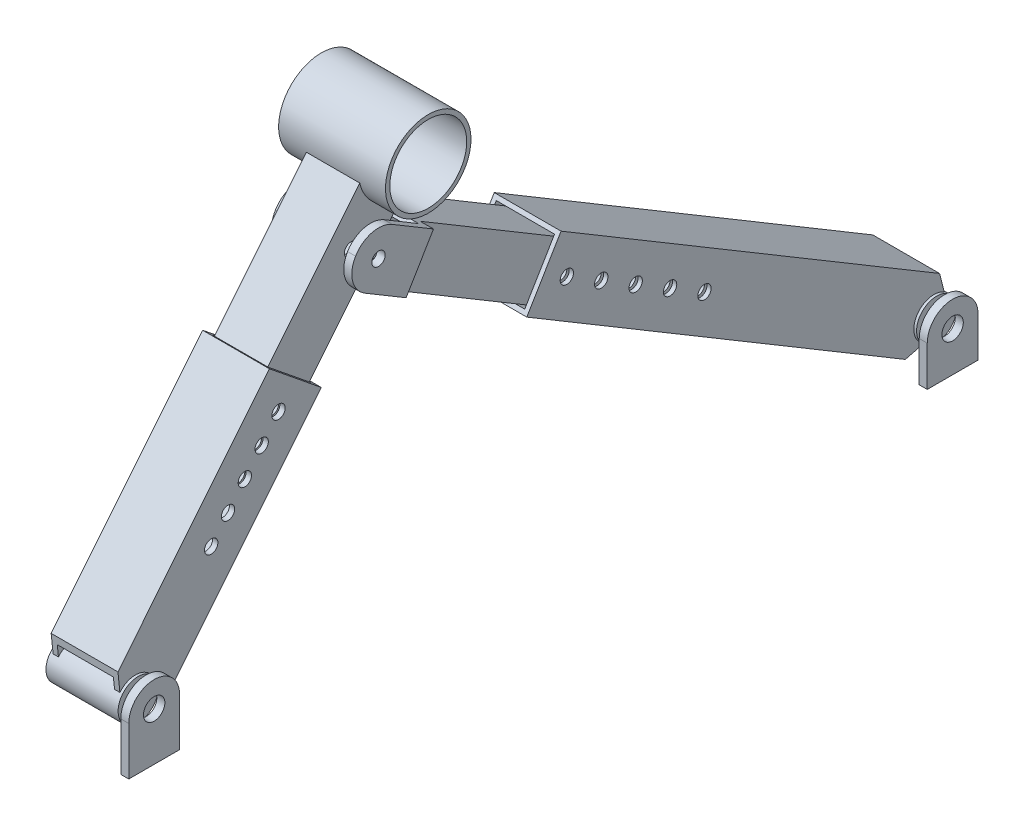
from build123d import *

# Parameters (mm, degrees)
SKETCH4_W              = 25
SKETCH4_H              = 25
SKETCH4_W_2            = 21
SKETCH4_H_2            = 21
BOSS_EXTRUDE3_DEPTH    = 95
SKETCH9_W              = 25
SKETCH9_H              = 25
SKETCH9_W_2            = 21.8
SKETCH9_H_2            = 21.8
BOSS_EXTRUDE6_DEPTH    = 170
SKETCH7_R              = 7.5
CUT_EXTRUDE2_DEPTH     = 85
SKETCH2_R              = 7.5
SKETCH2_R_2            = 4
BOSS_EXTRUDE2_DEPTH    = 13.5
BOSS_EXTRUDE4_START    = 60
SKETCH5_W              = 20
SKETCH5_H              = 20
SKETCH5_W_2            = 16
SKETCH5_H_2            = 16
BOSS_EXTRUDE4_DEPTH    = 72.060893
BOSS_EXTRUDE7_START    = -70
SKETCH10_W             = 20
SKETCH10_H             = 20
SKETCH10_W_2           = 16
SKETCH10_H_2           = 16
BOSS_EXTRUDE7_DEPTH    = 160
SKETCH17_W             = 20
SKETCH17_H             = 20
SKETCH17_W_2           = 16
SKETCH17_H_2           = 16
BOSS_EXTRUDE11_DEPTH   = 30
SKETCH11_R             = 16
CUT_EXTRUDE3_DEPTH     = 12.5
SKETCH12_R             = 16
SKETCH12_R_2           = 14.4
BOSS_EXTRUDE8_DEPTH    = 20
CHAMFER1_SIZE          = 5
CHAMFER2_SIZE          = 5
SKETCH13_R             = 2.5
CUT_EXTRUDE4_DEPTH     = 20
SKETCH15_R             = 2.5
CUT_EXTRUDE5_DEPTH     = 20
LPATTERN1_COUNT        = 5
LPATTERN1_PITCH        = 10
LPATTERN2_COUNT        = 5
LPATTERN2_PITCH        = 15
BOSS_EXTRUDE10_START   = 18
SKETCH16_R             = 4
BOSS_EXTRUDE10_DEPTH   = 1.5
BOSS_EXTRUDE10_2_DEPTH = 1.5
SKETCH18_W             = 5
SKETCH18_H             = 20
BOSS_EXTRUDE12_DEPTH   = 3
SKETCH19_W             = 3
SKETCH19_H             = 20
BOSS_EXTRUDE13_DEPTH   = 25
FILLET1_R              = 10
SKETCH20_R             = 2.5
CUT_EXTRUDE6_DEPTH     = 25
SKETCH21_R             = 2.5
CUT_EXTRUDE7_DEPTH     = 40


# Some blends are built 0.0001 mm under size
with BuildPart() as part:
    # Sketch4 → Boss-Extrude3 (new body)
    with BuildSketch(Plane(origin=(0, 0, 0), x_dir=(-1, 0, 0), z_dir=(0, 0.776655857872885, -0.629925137164515))):
        Rectangle(SKETCH4_W, SKETCH4_H)
        Rectangle(SKETCH4_W_2, SKETCH4_H_2, mode=Mode.SUBTRACT)
    extrude(amount=BOSS_EXTRUDE3_DEPTH)


with BuildPart() as body_2:
    # Sketch9 → Boss-Extrude6 (new body)
    with BuildSketch(Plane(origin=(0, -26.146722824, -298.858409428), x_dir=(-1, 0, 0), z_dir=(0, -0.5124761188021193, -0.858701477614611))):
        Rectangle(SKETCH9_W, SKETCH9_H)
        Rectangle(SKETCH9_W_2, SKETCH9_H_2, mode=Mode.SUBTRACT)
    extrude(amount=-BOSS_EXTRUDE6_DEPTH)


with BuildPart() as cut_extrude2_tool:
    # Sketch7 → Cut-Extrude2 (new, symmetric)
    with BuildSketch(Plane(origin=(0, 0, 0), x_dir=(0, 0, -1), z_dir=(1, 0, 0))):
        Circle(SKETCH7_R)
        with Locations((298.858409428, -26.146722824)):
            Circle(SKETCH7_R)
    extrude(amount=CUT_EXTRUDE2_DEPTH, both=True)


with BuildPart() as part_1:
    add(part.part)

    # Cut-Extrude2: cut by cut_extrude2_tool
    add(cut_extrude2_tool.part, mode=Mode.SUBTRACT)



with BuildPart() as body_2_1:
    add(body_2.part)

    # Cut-Extrude2: cut by cut_extrude2_tool
    add(cut_extrude2_tool.part, mode=Mode.SUBTRACT)


with BuildPart() as part_2:
    add(part_1.part)

    add(body_2_1.part)  # Boss-Extrude2 merges body 2
    # Sketch2 → Boss-Extrude2 (add, symmetric)
    # profile 1 of 2: a face of its own
    with BuildSketch(Plane(origin=(0, 0, 0), x_dir=(0, 0, -1), z_dir=(1, 0, 0))):
        Circle(SKETCH2_R)
        Circle(SKETCH2_R_2, mode=Mode.SUBTRACT)
    # profile 2 of 2: a face of its own
    with BuildSketch(Plane(origin=(0, 0, 0), x_dir=(0, 0, -1), z_dir=(1, 0, 0))):
        with Locations((298.858409428, -26.146722824)):
            Circle(SKETCH2_R)
        with Locations((298.858409428, -26.146722824)):
            Circle(SKETCH2_R_2, mode=Mode.SUBTRACT)
    extrude(amount=BOSS_EXTRUDE2_DEPTH, both=True)

    # Chamfer1
    # the kernel refuses this chamfer: 5 mm, written as the material it takes off along each edge
    with BuildSketch(Plane(origin=(25.35841494, -7.874064215, -9.708198223), x_dir=(0, 0.7590418735818988, -0.6510418067599658), z_dir=(-1, 0, 0))) as chamfer1_piece_1_section:
        Polygon((CHAMFER1_SIZE * 0.999621916911, -CHAMFER1_SIZE * 0.0274958766106), (-CHAMFER1_SIZE * 0.0274958766106, -CHAMFER1_SIZE * 0.999621916911), (0, 0), align=None)
    chamfer1_piece_1 = extrude(amount=50.71682988, mode=Mode.PRIVATE)
    chamfer1_piece_1 = chamfer1_piece_1 - Plane(origin=(0, 0, 0), x_dir=(0, 0, -1), z_dir=(1, 0, 0)) * Cylinder(7.5, 122, mode=Mode.PRIVATE)
    add(chamfer1_piece_1, mode=Mode.SUBTRACT)
    with BuildSketch(Plane(origin=(-25.35841494, 7.874064215, 9.708198223), x_dir=(0, -0.651041806759966, -0.7590418735818988), z_dir=(1, 0, 0))) as chamfer1_piece_2_section:
        Polygon((CHAMFER1_SIZE * 0.999621916911, CHAMFER1_SIZE * 0.0274958766106), (-CHAMFER1_SIZE * 0.0274958766106, CHAMFER1_SIZE * 0.999621916911), (0, 0), align=None)
    chamfer1_piece_2 = extrude(amount=50.71682988, mode=Mode.PRIVATE)
    chamfer1_piece_2 = chamfer1_piece_2 - Plane(origin=(0, 0, 0), x_dir=(0, 0, -1), z_dir=(1, 0, 0)) * Cylinder(7.5, 122, mode=Mode.PRIVATE)
    add(chamfer1_piece_2, mode=Mode.SUBTRACT)

    # Chamfer2
    # the kernel refuses this chamfer: 5 mm, written as the material it takes off along each edge
    with BuildSketch(Plane(origin=(25.35841494, -15.412954354, -305.264360913), x_dir=(0, 0.5358931101220563, 0.8442858369792244), z_dir=(-1, 0, 0))) as chamfer2_piece_1_section:
        Polygon((CHAMFER2_SIZE * 0.999621916911, -CHAMFER2_SIZE * 0.0274958766106), (-CHAMFER2_SIZE * 0.0274958766106, -CHAMFER2_SIZE * 0.999621916911), (0, 0), align=None)
    chamfer2_piece_1 = extrude(amount=50.71682988, mode=Mode.PRIVATE)
    chamfer2_piece_1 = chamfer2_piece_1 - Plane(origin=(0, -26.146722824, -298.858409428), x_dir=(0, 0, -1), z_dir=(1, 0, 0)) * Cylinder(7.5, 122, mode=Mode.PRIVATE)
    add(chamfer2_piece_1, mode=Mode.SUBTRACT)
    with BuildSketch(Plane(origin=(-25.35841494, -36.880491294, -292.452457942), x_dir=(0, 0.4886716103744133, 0.8724677972361372), z_dir=(1, 0, 0))) as chamfer2_piece_2_section:
        Polygon((CHAMFER2_SIZE * 0.999621916911, -CHAMFER2_SIZE * 0.0274958766106), (-CHAMFER2_SIZE * 0.0274958766106, -CHAMFER2_SIZE * 0.999621916911), (0, 0), align=None)
    chamfer2_piece_2 = extrude(amount=50.71682988, mode=Mode.PRIVATE)
    chamfer2_piece_2 = chamfer2_piece_2 - Plane(origin=(0, -26.146722824, -298.858409428), x_dir=(0, 0, -1), z_dir=(1, 0, 0)) * Cylinder(7.5, 122, mode=Mode.PRIVATE)
    add(chamfer2_piece_2, mode=Mode.SUBTRACT)


with BuildPart() as body_2_2:
    # Sketch5 → Boss-Extrude4 (new body)
    with BuildSketch(Plane(origin=(0, 0, 0), x_dir=(-1, 0, 0), z_dir=(0, 0.776655857872885, -0.629925137164515)).offset(BOSS_EXTRUDE4_START)):
        Rectangle(SKETCH5_W, SKETCH5_H)
        Rectangle(SKETCH5_W_2, SKETCH5_H_2, mode=Mode.SUBTRACT)
    extrude(amount=BOSS_EXTRUDE4_DEPTH)

    # Sketch17 → Boss-Extrude11 (add)
    with BuildSketch(Plane(origin=(0, 102.56586616, -83.18847615), x_dir=(1, 0, 0), z_dir=(0, 0.7766558578728849, -0.6299251371645154))):
        Rectangle(SKETCH17_W, SKETCH17_H)
        Rectangle(SKETCH17_W_2, SKETCH17_H_2, mode=Mode.SUBTRACT)
    extrude(amount=BOSS_EXTRUDE11_DEPTH)

    # Sketch11 → Cut-Extrude3 (cut, symmetric)
    with BuildSketch(Plane(origin=(0, 0, 0), x_dir=(0, 0, -1), z_dir=(1, 0, 0))):
        with Locations((102.086230265, 125.865541896)):
            Circle(SKETCH11_R)
    extrude(amount=CUT_EXTRUDE3_DEPTH, both=True, mode=Mode.SUBTRACT)

    # Sketch12 → Boss-Extrude8 (add, symmetric)
    with BuildSketch(Plane(origin=(0, 0, 0), x_dir=(0, 0, -1), z_dir=(1, 0, 0))):
        with Locations((102.086230265, 125.865541896)):
            Circle(SKETCH12_R)
        with Locations((102.086230265, 125.865541896)):
            Circle(SKETCH12_R_2, mode=Mode.SUBTRACT)
    extrude(amount=BOSS_EXTRUDE8_DEPTH, both=True)


with BuildPart() as body_3:
    # Sketch10 → Boss-Extrude7 (new body)
    with BuildSketch(Plane(origin=(0, -26.146722824, -298.858409428), x_dir=(-1, 0, 0), z_dir=(0, -0.5124761188021193, -0.858701477614611)).offset(BOSS_EXTRUDE7_START)):
        Rectangle(SKETCH10_W, SKETCH10_H)
        Rectangle(SKETCH10_W_2, SKETCH10_H_2, mode=Mode.SUBTRACT)
    extrude(amount=-BOSS_EXTRUDE7_DEPTH)


with BuildPart() as cut_extrude4_tool:
    # Sketch13 → Cut-Extrude4 (new, symmetric)
    with BuildSketch(Plane(origin=(0, 0, 0), x_dir=(0, 0, -1), z_dir=(1, 0, 0))):
        with Locations(Location((53.543636659, 66.015747919, 0), (0, 0, 180))):
            Circle(SKETCH13_R)
    cut_extrude4 = extrude(amount=CUT_EXTRUDE4_DEPTH, both=True)


with BuildPart() as part_3:
    add(part_2.part)

    # Cut-Extrude4: cut by cut_extrude4_tool
    add(cut_extrude4_tool.part, mode=Mode.SUBTRACT)


with BuildPart() as body_2_2_1:
    add(body_2_2.part)

    # Cut-Extrude4: cut by cut_extrude4_tool
    add(cut_extrude4_tool.part, mode=Mode.SUBTRACT)


with BuildPart() as cut_extrude5_tool:
    # Sketch15 → Cut-Extrude5 (new, symmetric)
    with BuildSketch(Plane(origin=(0, 0, 0), x_dir=(0, 0, -1), z_dir=(1, 0, 0))):
        with Locations(Location((161.466173009, 55.849456184, 0), (0, 0, 180))):
            Circle(SKETCH15_R)
    cut_extrude5 = extrude(amount=CUT_EXTRUDE5_DEPTH, both=True)


with BuildPart() as part_4:
    add(part_3.part)

    # Cut-Extrude5: cut by cut_extrude5_tool
    add(cut_extrude5_tool.part, mode=Mode.SUBTRACT)


with BuildPart() as body_3_1:
    add(body_3.part)

    # Cut-Extrude5: cut by cut_extrude5_tool
    add(cut_extrude5_tool.part, mode=Mode.SUBTRACT)


with BuildPart() as lpattern1_tool:
    # LPattern1: Cut-Extrude4 ×5
    with Locations(*[Vector(0, -0.7766558578728853, 0.6299251371645148) * (i * LPATTERN1_PITCH) for i in range(1, LPATTERN1_COUNT)]):
        add(cut_extrude4)


with BuildPart() as part_5:
    add(part_4.part)

    # LPattern1: cut by lpattern1_tool
    add(lpattern1_tool.part, mode=Mode.SUBTRACT)


with BuildPart() as body_2_2_2:
    add(body_2_2_1.part)

    # LPattern1: cut by lpattern1_tool
    add(lpattern1_tool.part, mode=Mode.SUBTRACT)

    # Sketch20 → Cut-Extrude6 (cut)
    with BuildSketch(Plane(origin=(10, 0, 0), x_dir=(0, 0, -1), z_dir=(1, 0, 0))):
        with Locations((83.18847615, 102.56586616)):
            Circle(SKETCH20_R)
    extrude(amount=-CUT_EXTRUDE6_DEPTH, mode=Mode.SUBTRACT)


with BuildPart() as lpattern2_tool:
    # LPattern2: Cut-Extrude5 ×5
    with Locations(*[Vector(0, -0.5124761188021193, -0.8587014776146109) * (i * LPATTERN2_PITCH) for i in range(1, LPATTERN2_COUNT)]):
        add(cut_extrude5)


with BuildPart() as part_6:
    add(part_5.part)

    # LPattern2: cut by lpattern2_tool
    add(lpattern2_tool.part, mode=Mode.SUBTRACT)


with BuildPart() as body_3_2:
    add(body_3_1.part)

    # LPattern2: cut by lpattern2_tool
    add(lpattern2_tool.part, mode=Mode.SUBTRACT)

    # Sketch18 → Boss-Extrude12 (add)
    with BuildSketch(Plane(origin=(0, -20.514280055, -34.373587274), x_dir=(1, 0, 0), z_dir=(0, 0.5124761188021189, 0.8587014776146111))):
        with Locations((-12.5, 130.705568211)):
            Rectangle(SKETCH18_W, SKETCH18_H)
        with Locations((12.5, 130.705568211)):
            Rectangle(SKETCH18_W, SKETCH18_H)
    extrude(amount=-BOSS_EXTRUDE12_DEPTH)

    # Sketch19 → Boss-Extrude13 (add)
    with BuildSketch(Plane(origin=(0, -20.514280055, -34.373587274), x_dir=(1, 0, 0), z_dir=(0, 0.5124761188021189, 0.8587014776146111))):
        with Locations((-13.5, 130.705568211)):
            Rectangle(SKETCH19_W, SKETCH19_H)
        with Locations((13.5, 130.705568211)):
            Rectangle(SKETCH19_W, SKETCH19_H)
    extrude(amount=BOSS_EXTRUDE13_DEPTH)

    # Fillet1
    fillet1_edges = [body_3_2.edges().sort_by_distance(p)[0] for p in [
        (-13.5, 95.947672694, -74.764771448),
        (-13.5, 113.121702246, -85.014293824),
        (13.5, 113.121702246, -85.014293824),
        (13.5, 95.947672694, -74.764771448),
    ]]
    fillet(fillet1_edges, radius=FILLET1_R - 0.0001)  # a hair under: the kernel refuses the full size

    # Sketch21 → Cut-Extrude7 (cut)
    with BuildSketch(Plane(origin=(15, 0, 0), x_dir=(0, 0, -1), z_dir=(1, 0, 0))):
        with Locations(Location((88.476547412, 99.409926282, 0), (0, 0, 90))):
            Circle(SKETCH21_R)
    extrude(amount=-CUT_EXTRUDE7_DEPTH, mode=Mode.SUBTRACT)


with BuildPart() as body_4:
    # Sketch16 → Boss-Extrude10 (new, symmetric)
    with BuildSketch(Plane(origin=(0, 0, 0), x_dir=(0, 0, -1), z_dir=(1, 0, 0)).offset(BOSS_EXTRUDE10_START)):
        with BuildLine():
            Line((-9.5, 0), (-9.5, -18))
            Line((-9.5, -18), (9.5, -18))
            Line((9.5, -18), (9.5, 0))
            ThreePointArc((9.5, 0), (0, 9.5), (-9.5, 0))
        make_face()
        Circle(SKETCH16_R, mode=Mode.SUBTRACT)
    extrude(amount=BOSS_EXTRUDE10_DEPTH, both=True)


with BuildPart() as body_5:
    # Sketch16 → Boss-Extrude10 2 (new, symmetric)
    with BuildSketch(Plane(origin=(0, 0, 0), x_dir=(0, 0, -1), z_dir=(1, 0, 0)).offset(BOSS_EXTRUDE10_START)):
        with BuildLine():
            Line((289.358409428, -26.146722824), (289.358409428, -41.146722824))
            Line((289.358409428, -41.146722824), (308.358409428, -41.146722824))
            Line((308.358409428, -41.146722824), (308.358409428, -26.146722824))
            ThreePointArc((308.358409428, -26.146722824), (298.858409428, -16.646722824), (289.358409428, -26.146722824))
        make_face()
        with Locations((298.858409428, -26.146722824)):
            Circle(SKETCH16_R, mode=Mode.SUBTRACT)
    extrude(amount=BOSS_EXTRUDE10_2_DEPTH, both=True)


solid = Compound([body_2_2_2.part, part_6.part, body_3_2.part, body_4.part, body_5.part])
